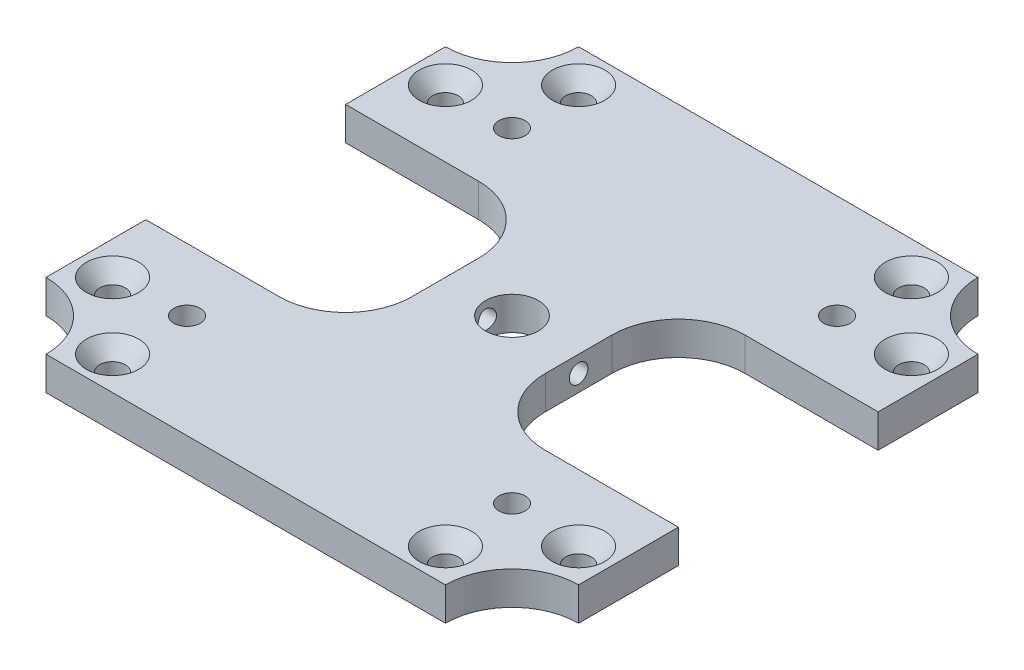
from build123d import *

# Parameters (mm, degrees)
SKETCH3_W                         = 50.8
SKETCH3_H                         = 50.8
BOSS_EXTRUDE1_DEPTH               = 3.175
F_2_CLEARANCE_HOLE1_AT_2_COUNT    = 2
F_2_CLEARANCE_HOLE1_AT_2_PITCH    = 8.980256121
F_2_CLEARANCE_HOLE1_AT_3_COUNT    = 2
F_2_CLEARANCE_HOLE1_AT_3_PITCH    = 31.75
F_2_CLEARANCE_HOLE1_AT_4_COUNT    = 2
F_2_CLEARANCE_HOLE1_AT_4_PITCH    = 38.625542067
F_2_CLEARANCE_HOLE1_AT_5_COUNT    = 2
F_2_CLEARANCE_HOLE1_AT_5_PITCH    = 53.881536726
F_2_CLEARANCE_HOLE1_AT_6_COUNT    = 2
F_2_CLEARANCE_HOLE1_AT_6_PITCH    = 54.624765446
F_2_CLEARANCE_HOLE1_AT_7_COUNT    = 2
F_2_CLEARANCE_HOLE1_AT_7_PITCH    = 44.45
F_2_CLEARANCE_HOLE1_AT_8_COUNT    = 2
F_2_CLEARANCE_HOLE1_AT_8_PITCH    = 38.625542067
TAP_DRILL_FOR_M3X0_5_TAP1_D       = 2.5
CUT_EXTRUDE1_REACH                = 38.478
SKETCH15_R                        = 2.52095
CUT_EXTRUDE2_REACH                = 38.061
SKETCH16_R                        = 6.35
CUT_EXTRUDE3_REACH                = 38.061
SKETCH17_W                        = 19.05
SKETCH17_H                        = 19.05
FILLET1_R                         = 6.35
TAP_START                         = -6.35
TAP_DRILL_FOR_2_56_TAP2_OUTLINE_R = 0.889
TAP_DRILL_FOR_2_56_TAP2_DEPTH     = 12.7


# Read off the part's stored shape, not the designer's step: Tap Drill for #2-56 Tap2
with BuildPart() as part:
    # Sketch3 → Boss-Extrude1 (new body)
    with BuildSketch(Plane(origin=(0, 15.242340102, 0), x_dir=(1, 0, 0), z_dir=(0, 1, 0))):
        Rectangle(SKETCH3_W, SKETCH3_H)
    extrude(amount=BOSS_EXTRUDE1_DEPTH)

    # Sketch13 → #2 Clearance Hole1 (revolve, cut)
    with BuildSketch(Plane(origin=(-22.225, 15.242340102, -15.875), x_dir=(0, 0, -1), z_dir=(1, 0, 0))):
        Polygon((0, 0), (0, 3.175), (2.5019, 3.175), (1.2192, 1.699422444), (1.2192, 0), align=None)
    f_2_clearance_hole1 = revolve(axis=Axis((-22.225, 8.892340102, -15.875), (0, 1, 0)), mode=Mode.SUBTRACT)

    # #2 Clearance Hole1 at 2: #2 Clearance Hole1 ×2
    with Locations(*[Vector(0.7071067811865474, 0, -0.7071067811865477) * (i * F_2_CLEARANCE_HOLE1_AT_2_PITCH) for i in range(1, F_2_CLEARANCE_HOLE1_AT_2_COUNT)]):
        add(f_2_clearance_hole1, mode=Mode.SUBTRACT)

    # #2 Clearance Hole1 at 3: #2 Clearance Hole1 ×2
    with Locations(*[(0, 0, i * F_2_CLEARANCE_HOLE1_AT_3_PITCH) for i in range(1, F_2_CLEARANCE_HOLE1_AT_3_COUNT)]):
        add(f_2_clearance_hole1, mode=Mode.SUBTRACT)

    # #2 Clearance Hole1 at 4: #2 Clearance Hole1 ×2
    with Locations(*[Vector(0.1643989873053571, 0, 0.9863939238321437) * (i * F_2_CLEARANCE_HOLE1_AT_4_PITCH) for i in range(1, F_2_CLEARANCE_HOLE1_AT_4_COUNT)]):
        add(f_2_clearance_hole1, mode=Mode.SUBTRACT)

    # #2 Clearance Hole1 at 5: #2 Clearance Hole1 ×2
    with Locations(*[Vector(0.7071067811865476, 0, 0.7071067811865476) * (i * F_2_CLEARANCE_HOLE1_AT_5_PITCH) for i in range(1, F_2_CLEARANCE_HOLE1_AT_5_COUNT)]):
        add(f_2_clearance_hole1, mode=Mode.SUBTRACT)

    # #2 Clearance Hole1 at 6: #2 Clearance Hole1 ×2
    with Locations(*[Vector(0.8137334712067349, 0, 0.5812381937190967) * (i * F_2_CLEARANCE_HOLE1_AT_6_PITCH) for i in range(1, F_2_CLEARANCE_HOLE1_AT_6_COUNT)]):
        add(f_2_clearance_hole1, mode=Mode.SUBTRACT)

    # #2 Clearance Hole1 at 7: #2 Clearance Hole1 ×2
    with Locations(*[(i * F_2_CLEARANCE_HOLE1_AT_7_PITCH, 0, 0) for i in range(1, F_2_CLEARANCE_HOLE1_AT_7_COUNT)]):
        add(f_2_clearance_hole1, mode=Mode.SUBTRACT)

    # #2 Clearance Hole1 at 8: #2 Clearance Hole1 ×2
    with Locations(*[Vector(0.9863939238321437, 0, -0.16439898730535735) * (i * F_2_CLEARANCE_HOLE1_AT_8_PITCH) for i in range(1, F_2_CLEARANCE_HOLE1_AT_8_COUNT)]):
        add(f_2_clearance_hole1, mode=Mode.SUBTRACT)

    # Tap Drill for M3x0.5 Tap1 (through all)
    with Locations(Plane(origin=(0, 15.242340102, 0), x_dir=(-1, 0, 0), z_dir=(0, -1, 0))):
        with Locations((15.499999988, 15.499999988), (15.499999988, -15.499999988), (-15.499999988, -15.499999988), (-15.499999988, 15.499999988)):
            Hole(TAP_DRILL_FOR_M3X0_5_TAP1_D / 2)

    # Sketch15 → Cut-Extrude1 (cut, up to next)
    with BuildSketch(Plane(origin=(0, 21.592340102, 0), x_dir=(1, 0, 0), z_dir=(0, 1, 0)), mode=Mode.PRIVATE) as cut_extrude1_sk1:
        with Locations(Location((0, 0, 0), (0, 0, 270))):
            Circle(SKETCH15_R)
    cut_extrude1_tool1 = extrude(cut_extrude1_sk1.sketch, amount=-CUT_EXTRUDE1_REACH, mode=Mode.PRIVATE) & part.part
    add(cut_extrude1_tool1.solids().sort_by_distance((0, 21.59234, 0))[0], mode=Mode.SUBTRACT)

    # Sketch16 → Cut-Extrude2 (cut, up to next)
    with BuildSketch(Plane(origin=(0, 18.417340102, 0), x_dir=(1, 0, 0), z_dir=(0, 1, 0)), mode=Mode.PRIVATE) as cut_extrude2_sk1:
        with Locations((25.4, 25.4)):
            Circle(SKETCH16_R)
    cut_extrude2_tool1 = extrude(cut_extrude2_sk1.sketch, amount=-CUT_EXTRUDE2_REACH, mode=Mode.PRIVATE) & part.part
    # Sketch16 → Cut-Extrude2 (cut, up to next)
    with BuildSketch(Plane(origin=(0, 18.417340102, 0), x_dir=(1, 0, 0), z_dir=(0, 1, 0)), mode=Mode.PRIVATE) as cut_extrude2_sk2:
        with Locations((25.4, -25.4)):
            Circle(SKETCH16_R)
    cut_extrude2_tool2 = extrude(cut_extrude2_sk2.sketch, amount=-CUT_EXTRUDE2_REACH, mode=Mode.PRIVATE) & part.part
    # Sketch16 → Cut-Extrude2 (cut, up to next)
    with BuildSketch(Plane(origin=(0, 18.417340102, 0), x_dir=(1, 0, 0), z_dir=(0, 1, 0)), mode=Mode.PRIVATE) as cut_extrude2_sk3:
        with Locations((-25.4, -25.4)):
            Circle(SKETCH16_R)
    cut_extrude2_tool3 = extrude(cut_extrude2_sk3.sketch, amount=-CUT_EXTRUDE2_REACH, mode=Mode.PRIVATE) & part.part
    # Sketch16 → Cut-Extrude2 (cut, up to next)
    with BuildSketch(Plane(origin=(0, 18.417340102, 0), x_dir=(1, 0, 0), z_dir=(0, 1, 0)), mode=Mode.PRIVATE) as cut_extrude2_sk4:
        with Locations((-25.4, 25.4)):
            Circle(SKETCH16_R)
    cut_extrude2_tool4 = extrude(cut_extrude2_sk4.sketch, amount=-CUT_EXTRUDE2_REACH, mode=Mode.PRIVATE) & part.part
    add(cut_extrude2_tool1.solids().sort_by_distance((25.4, 18.41734, -25.4))[0], mode=Mode.SUBTRACT)
    add(cut_extrude2_tool2.solids().sort_by_distance((25.4, 18.41734, 25.4))[0], mode=Mode.SUBTRACT)
    add(cut_extrude2_tool3.solids().sort_by_distance((-25.4, 18.41734, 25.4))[0], mode=Mode.SUBTRACT)
    add(cut_extrude2_tool4.solids().sort_by_distance((-25.4, 18.41734, -25.4))[0], mode=Mode.SUBTRACT)

    # Sketch17 → Cut-Extrude3 (cut, up to next)
    with BuildSketch(Plane(origin=(0, 18.417340102, 0), x_dir=(1, 0, 0), z_dir=(0, 1, 0)), mode=Mode.PRIVATE) as cut_extrude3_sk1:
        with Locations((15.875, 0)):
            Rectangle(SKETCH17_W, SKETCH17_H)
    cut_extrude3_tool1 = extrude(cut_extrude3_sk1.sketch, amount=-CUT_EXTRUDE3_REACH, mode=Mode.PRIVATE) & part.part
    # Sketch17 → Cut-Extrude3 (cut, up to next)
    with BuildSketch(Plane(origin=(0, 18.417340102, 0), x_dir=(1, 0, 0), z_dir=(0, 1, 0)), mode=Mode.PRIVATE) as cut_extrude3_sk2:
        with Locations((-15.875, 0)):
            Rectangle(SKETCH17_W, SKETCH17_H)
    cut_extrude3_tool2 = extrude(cut_extrude3_sk2.sketch, amount=-CUT_EXTRUDE3_REACH, mode=Mode.PRIVATE) & part.part
    add(cut_extrude3_tool1.solids().sort_by_distance((15.875, 18.41734, 0))[0], mode=Mode.SUBTRACT)
    add(cut_extrude3_tool2.solids().sort_by_distance((-15.875, 18.41734, 0))[0], mode=Mode.SUBTRACT)

    # Fillet1
    fillet1_edges = [part.edges().sort_by_distance(p)[0] for p in [
        (6.35, 16.829840102, 9.525),
        (6.35, 16.829840102, -9.525),
        (-6.35, 16.829840102, -9.525),
        (-6.35, 16.829840102, 9.525),
    ]]
    fillet(fillet1_edges, radius=FILLET1_R)

    # Tap Drill for #2-56 Tap2 outline → Tap Drill for #2-56 Tap2 (cut)
    with BuildSketch(Plane.YZ.offset(TAP_START)):
        with Locations((16.829840102, 0)):
            Circle(TAP_DRILL_FOR_2_56_TAP2_OUTLINE_R)
    extrude(amount=TAP_DRILL_FOR_2_56_TAP2_DEPTH, mode=Mode.SUBTRACT)


solid = part.part
